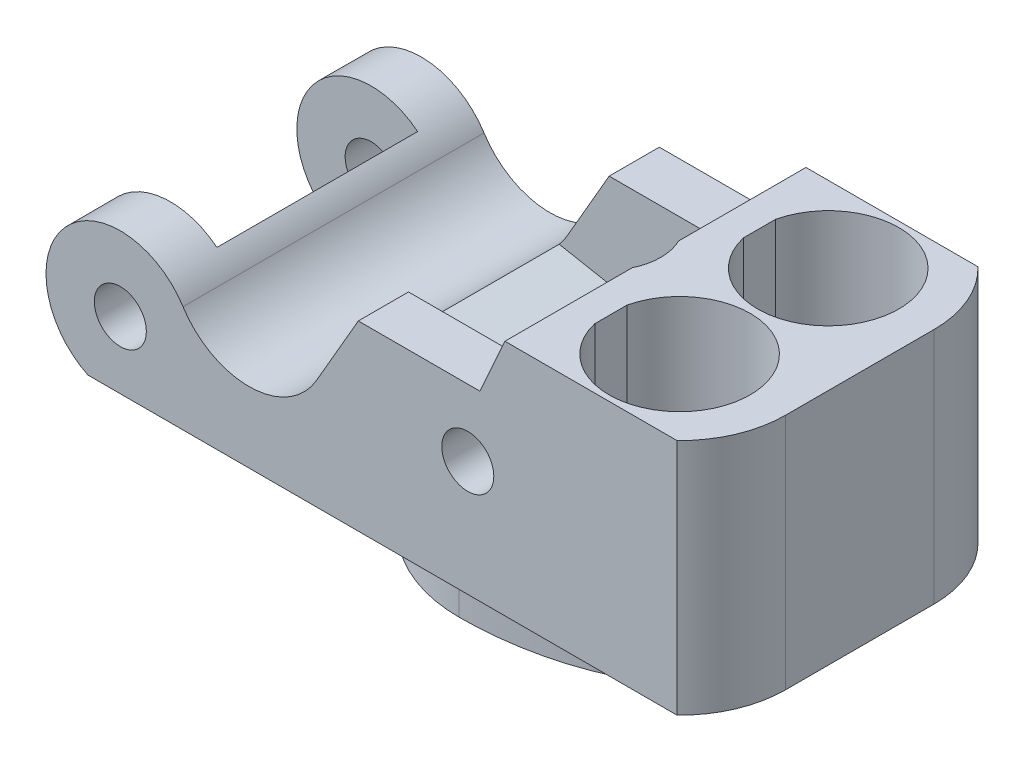
from build123d import *

# Parameters (mm, degrees)
BOSS_EXTRUDE1_DEPTH      = 40.5
BOSS_EXTRUDE1_DEPTH_BACK = 40.5
SKETCH1_R                = 7
CUT_EXTRUDE1_START       = -67.5
SKETCH2_R                = 12.499999991
SKETCH2_R_2              = 7
SKETCH2_R_3              = 12.5
CUT_EXTRUDE1_DEPTH       = 54
BOSS_EXTRUDE2_DEPTH      = 49.000000379
CUT_EXTRUDE2_START       = -14.999999621
SKETCH4_R                = 7.499999993
SKETCH4_R_2              = 1.499999993
CUT_EXTRUDE2_DEPTH       = 14.999999621
SKETCH5_R                = 6.999999993
CUT_EXTRUDE3_DEPTH       = 221.420620892
BOSS_EXTRUDE3_DEPTH      = 7
CUT_EXTRUDE6_START       = 10
SKETCH7_R                = 14.249999993
SKETCH7_R_2              = 6.999999993
CUT_EXTRUDE6_DEPTH       = 211.420621005


# Read off the part's stored shape, not the designer's step: Boss-Extrude3
with BuildPart() as part:
    # Sketch1 → Boss-Extrude1 (new, two sides: drawn at the far end of the back side and taken through both)
    with BuildSketch(Plane.XY.offset(-BOSS_EXTRUDE1_DEPTH_BACK)):
        with BuildLine():
            ThreePointArc((101.284221271, -32.899999986), (83.546912911, -43.395194612), (65.376921076, -33.668293007))
            ThreePointArc((65.376921076, -33.668293007), (33.566126775, -31.096638376), (39.782202113, -62.4))
            Line((39.782202113, -62.4), (207.000000276, -62.4))
            Line((207.000000276, -62.4), (207.000000276, -47.400000379))
            Line((207.000000276, -47.400000379), (160, -47.400000379))
            Line((160, -47.400000379), (160, 1.6))
            Line((160, 1.6), (152, 1.6))
            Line((152, 1.6), (145.25, -13.4))
            Line((145.25, -13.4), (112.542551513, -13.4))
            Line((112.542551513, -13.4), (101.284221271, -32.899999986))
        make_face()
        with Locations((142, -31.4)):
            Circle(SKETCH1_R, mode=Mode.SUBTRACT)
        with Locations((48.5, -44.4)):
            Circle(SKETCH1_R, mode=Mode.SUBTRACT)
    extrude(amount=BOSS_EXTRUDE1_DEPTH + BOSS_EXTRUDE1_DEPTH_BACK)

    # Sketch2 → Cut-Extrude1 (cut)
    # profile 1 of 4: a face of its own
    with BuildSketch(Plane.XY.offset(40.5).offset(CUT_EXTRUDE1_START)):
        with Locations((142, -31.4)):
            Circle(SKETCH2_R)
        with Locations(Location((142, -31.4, 0), (0, 0, 180))):
            Circle(SKETCH2_R_2, mode=Mode.SUBTRACT)
    # profile 2 of 4: a face of its own
    with BuildSketch(Plane.XY.offset(40.5).offset(CUT_EXTRUDE1_START)):
        with BuildLine():
            Line((61, -44.4), (61, -28.787505004))
            ThreePointArc((61, -28.787505004), (39.839745962, -26.372243623), (28.5, -44.4))
            ThreePointArc((28.5, -44.4), (29.628726859, -51.023824427), (32.887505004, -56.9))
            Line((32.887505004, -56.9), (48.5, -56.9))
            ThreePointArc((48.5, -56.9), (39.661165235, -35.561165235), (61, -44.4))
        make_face()
    # profile 3 of 4: a face of its own
    with BuildSketch(Plane.XY.offset(40.5).offset(CUT_EXTRUDE1_START)):
        with Locations((48.5, -44.4)):
            Circle(SKETCH2_R_3)
        with Locations(Location((48.5, -44.4, 0), (0, 0, 180))):
            Circle(SKETCH2_R_2, mode=Mode.SUBTRACT)
    # profile 4 of 4: a face of its own
    with BuildSketch(Plane.XY.offset(40.5).offset(CUT_EXTRUDE1_START)):
        with BuildLine():
            ThreePointArc((101.284221271, -32.899999986), (100.261640945, -34.499533541), (99.0987841, -36.000180759))
            Line((99.0987841, -36.000180759), (139.674860989, -43.681845488))
            ThreePointArc((139.674860991, -43.681845479), (134.025485527, -21.774143224), (154.499999991, -31.4))
            Line((154.5, -31.4), (154.5, -13.4))
            Line((154.5, -13.4), (145.25, -13.4))
            Line((145.25, -13.4), (112.542551513, -13.4))
            Line((112.542551513, -13.4), (101.284221271, -32.899999986))
        make_face()
    extrude(amount=CUT_EXTRUDE1_DEPTH, mode=Mode.SUBTRACT)

    # Sketch3 → Boss-Extrude2 (add)
    with BuildSketch(Plane(origin=(0, -47.400000379, 0), x_dir=(1, 0, 0), z_dir=(0, 1, 0))):
        with BuildLine():
            Line((198.298990268, 40.5), (160, 40.5))
            Line((160, 40.5), (160, 24.330126958))
            ThreePointArc((160, 24.330126958), (197.5, 20), (160, 15.669873042))
            Line((160, 15.669873042), (160, -15.669873042))
            ThreePointArc((160, -15.669873042), (197.5, -20), (160, -24.330126958))
            Line((160, -24.330126958), (160, -40.5))
            Line((160, -40.5), (198.298990268, -40.5))
            ThreePointArc((198.298990268, -40.5), (204.734721686, -31.135052483), (207.000000277, -20))
            Line((207.000000276, -20), (207.000000276, 20))
            ThreePointArc((207.000000277, 20), (204.734721686, 31.135052483), (198.298990268, 40.5))
        make_face()
    extrude(amount=BOSS_EXTRUDE2_DEPTH)

    # Sketch4 → Cut-Extrude2 (cut)
    with BuildSketch(Plane(origin=(0, -47.400000379, 0), x_dir=(1, 0, 0), z_dir=(0, 1, 0)).offset(CUT_EXTRUDE2_START)):
        with BuildLine():
            Line((207.000000276, 20), (207.000000276, 40.5))
            Line((207.000000276, 40.5), (198.298990268, 40.5))
            ThreePointArc((198.298990268, 40.5), (204.734721686, 31.135052483), (207.000000277, 20))
        make_face()
        with BuildLine():
            Line((207.000000276, -40.5), (207.000000276, -20))
            ThreePointArc((207.000000277, -20), (204.734721686, -31.135052483), (198.298990268, -40.5))
            Line((198.298990268, -40.5), (207.000000276, -40.5))
        make_face()
        with Locations(Location((171.500000007, -20, 0), (0, 0, 180))):
            Circle(SKETCH4_R)
        with Locations(Location((171.500000007, 20, 0), (0, 0, 180))):
            Circle(SKETCH4_R)
        with Locations(Location((178.500000007, 4.5, 0), (0, 0, 180))):
            Circle(SKETCH4_R_2)
        with Locations(Location((165.076606249, 12.25, 0), (0, 0, 180))):
            Circle(SKETCH4_R_2)
        with Locations(Location((191.923393766, 12.25, 0), (0, 0, 180))):
            Circle(SKETCH4_R_2)
        with Locations(Location((191.923393766, 27.75, 0), (0, 0, 180))):
            Circle(SKETCH4_R_2)
        with Locations(Location((178.500000007, 35.5, 0), (0, 0, 180))):
            Circle(SKETCH4_R_2)
        with Locations(Location((165.076606249, 27.75, 0), (0, 0, 180))):
            Circle(SKETCH4_R_2)
        with Locations(Location((165.076606249, -12.25, 0), (0, 0, 180))):
            Circle(SKETCH4_R_2)
        with Locations(Location((178.500000007, -4.5, 0), (0, 0, 180))):
            Circle(SKETCH4_R_2)
        with Locations(Location((191.923393766, -12.25, 0), (0, 0, 180))):
            Circle(SKETCH4_R_2)
        with Locations(Location((191.923393766, -27.75, 0), (0, 0, 180))):
            Circle(SKETCH4_R_2)
        with Locations(Location((178.500000007, -35.5, 0), (0, 0, 180))):
            Circle(SKETCH4_R_2)
        with Locations(Location((165.076606249, -27.75, 0), (0, 0, 180))):
            Circle(SKETCH4_R_2)
    extrude(amount=CUT_EXTRUDE2_DEPTH, mode=Mode.SUBTRACT)

    # Sketch5 → Cut-Extrude3 (cut, through all)
    with BuildSketch(Plane.XZ.offset(62.4)):
        with Locations((139.189011165, 0)):
            Circle(SKETCH5_R)
    extrude(amount=-CUT_EXTRUDE3_DEPTH, mode=Mode.SUBTRACT)

    # Boss-Extrude3 outline → Boss-Extrude3 (add)
    with BuildSketch(Plane.XZ.offset(62.4)):
        with BuildLine():
            ThreePointArc((139.189011157, 40), (99.189011157, 0), (139.189011157, -40))
            add(Edge.make_bspline(
                [(139.189011157, -40), (146.82843448, -40), (162.107281125, -38.078486158), (176.778501223, -31.90101694), (183.851500427, -26.99841863), (185.64679387, -25.589452029), (186.4885893, -24.893504667), (187.107516855, -24.363583077), (187.51172734, -24.005038173), (187.711696887, -23.824463012)],
                knots=[1.570796327, 1.570796327, 1.570796327, 1.570796327, 1.963495408, 2.35619449, 2.445236625, 2.478897191, 2.495727474, 2.512557757, 2.52938804, 2.52938804, 2.52938804, 2.52938804], degree=3))
            Line((187.711696887, -23.824463012), (187.711696887, 23.824463012))
            add(Edge.make_bspline(
                [(187.711696887, 23.824463012), (187.51172734, 24.005038173), (187.107516855, 24.363583077), (186.4885893, 24.893504667), (185.64679387, 25.589452029), (183.851500427, 26.99841863), (176.778501223, 31.90101694), (162.107281125, 38.078486158), (146.82843448, 40), (139.189011157, 40)],
                knots=[3.753797267, 3.753797267, 3.753797267, 3.753797267, 3.77062755, 3.787457833, 3.804288116, 3.837948682, 3.926990817, 4.319689899, 4.71238898, 4.71238898, 4.71238898, 4.71238898], degree=3))
        make_face()
        with BuildLine():
            add(Edge.make_bspline(
                [(139.189011157, -35), (166.137629731, -35), (182.711696887, -21.525865932)],
                knots=[1.570796327, 1.570796327, 1.570796327, 2.479175311, 2.479175311, 2.479175311], degree=2, weights=[1, 0.898616921, 1]))
            ThreePointArc((139.189011157, -35), (104.189011157, 0), (139.189011157, 35))
            add(Edge.make_bspline(
                [(182.711696887, 21.525865932), (166.137629731, 35), (139.189011157, 35)],
                knots=[3.804009997, 3.804009997, 3.804009997, 4.71238898, 4.71238898, 4.71238898], degree=2, weights=[1, 0.898616921, 1]))
            Line((182.711696887, 21.525865932), (182.711696887, -21.525865932))
        make_face(mode=Mode.SUBTRACT)
    extrude(amount=BOSS_EXTRUDE3_DEPTH)

    # Sketch7 → Cut-Extrude6 (cut, through all)
    # profile 1 of 2: a face of its own
    with BuildSketch(Plane(origin=(0, -62.4, 0), x_dir=(1, 0, 0), z_dir=(0, 1, 0)).offset(CUT_EXTRUDE6_START)):
        with Locations((139.189011165, 0)):
            Circle(SKETCH7_R)
        with Locations((139.189011165, 0)):
            Circle(SKETCH7_R_2, mode=Mode.SUBTRACT)
    # profile 2 of 2: a face of its own
    with BuildSketch(Plane(origin=(0, -62.4, 0), x_dir=(1, 0, 0), z_dir=(0, 1, 0)).offset(CUT_EXTRUDE6_START)):
        with Locations((139.189011165, 0)):
            Circle(SKETCH7_R_2)
    extrude(amount=CUT_EXTRUDE6_DEPTH, mode=Mode.SUBTRACT)


solid = part.part
